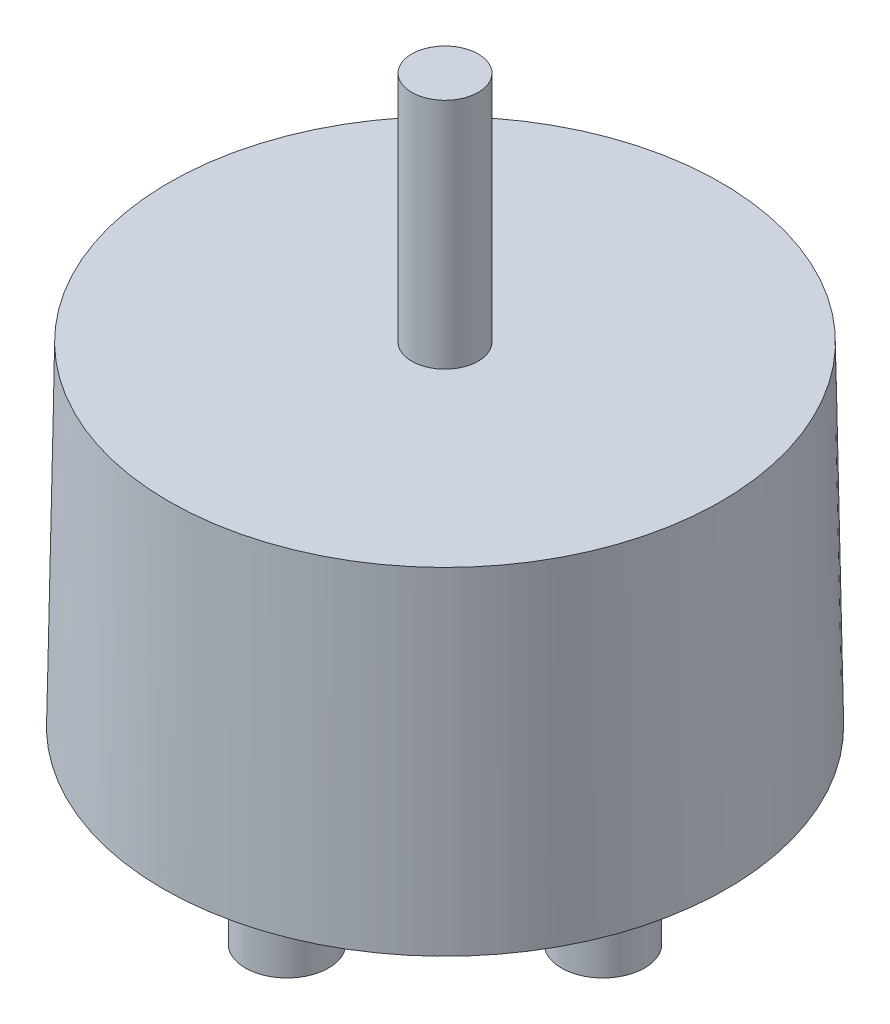
from build123d import *

# Parameters (mm, degrees)
SKETCH1_R           = 1.5
BOSS_EXTRUDE1_DEPTH = 6.6
SKETCH2_R           = 16.95
BOSS_EXTRUDE2_DEPTH = 20
BOSS_EXTRUDE2_TAPER = 1
SKETCH3_R           = 2
BOSS_EXTRUDE3_DEPTH = 14


with BuildPart() as part:
    # Sketch1 → Boss-Extrude1 (new body)
    with BuildSketch(Plane(origin=(0, 0, 0), x_dir=(1, 0, 0), z_dir=(0, 1, 0))):
        with BuildLine():
            ThreePointArc((-7.789473684, 1.823211376), (-12, 0), (-7.789473684, -1.823211376))
            ThreePointArc((-7.789473684, -1.823211376), (-3.570689148, -3.570689148), (-1.823211376, -7.789473684))
            ThreePointArc((-1.823211376, -7.789473684), (0, -12), (1.823211376, -7.789473684))
            ThreePointArc((1.823211376, -7.789473684), (3.570689148, -3.570689148), (7.789473684, -1.823211376))
            ThreePointArc((7.789473684, -1.823211376), (12, 0), (7.789473684, 1.823211376))
            ThreePointArc((7.789473684, 1.823211376), (3.570689148, 3.570689148), (1.823211376, 7.789473684))
            ThreePointArc((1.823211376, 7.789473684), (0, 12), (-1.823211376, 7.789473684))
            ThreePointArc((-1.823211376, 7.789473684), (-3.570689148, 3.570689148), (-7.789473684, 1.823211376))
        make_face()
        with Locations((0, 9.5)):
            Circle(SKETCH1_R, mode=Mode.SUBTRACT)
        with Locations((9.5, 0)):
            Circle(SKETCH1_R, mode=Mode.SUBTRACT)
        with Locations((0, -9.5)):
            Circle(SKETCH1_R, mode=Mode.SUBTRACT)
        with Locations((-9.5, 0)):
            Circle(SKETCH1_R, mode=Mode.SUBTRACT)
    extrude(amount=BOSS_EXTRUDE1_DEPTH)

    # Sketch2 → Boss-Extrude2 (add)
    with BuildSketch(Plane(origin=(0, 6.6, 0), x_dir=(1, 0, 0), z_dir=(0, 1, 0))):
        Circle(SKETCH2_R)
    extrude(amount=BOSS_EXTRUDE2_DEPTH, taper=BOSS_EXTRUDE2_TAPER)

    # Sketch3 → Boss-Extrude3 (add)
    with BuildSketch(Plane(origin=(0, 26.6, 0), x_dir=(1, 0, 0), z_dir=(0, 1, 0))):
        Circle(SKETCH3_R)
    extrude(amount=BOSS_EXTRUDE3_DEPTH)


solid = part.part
